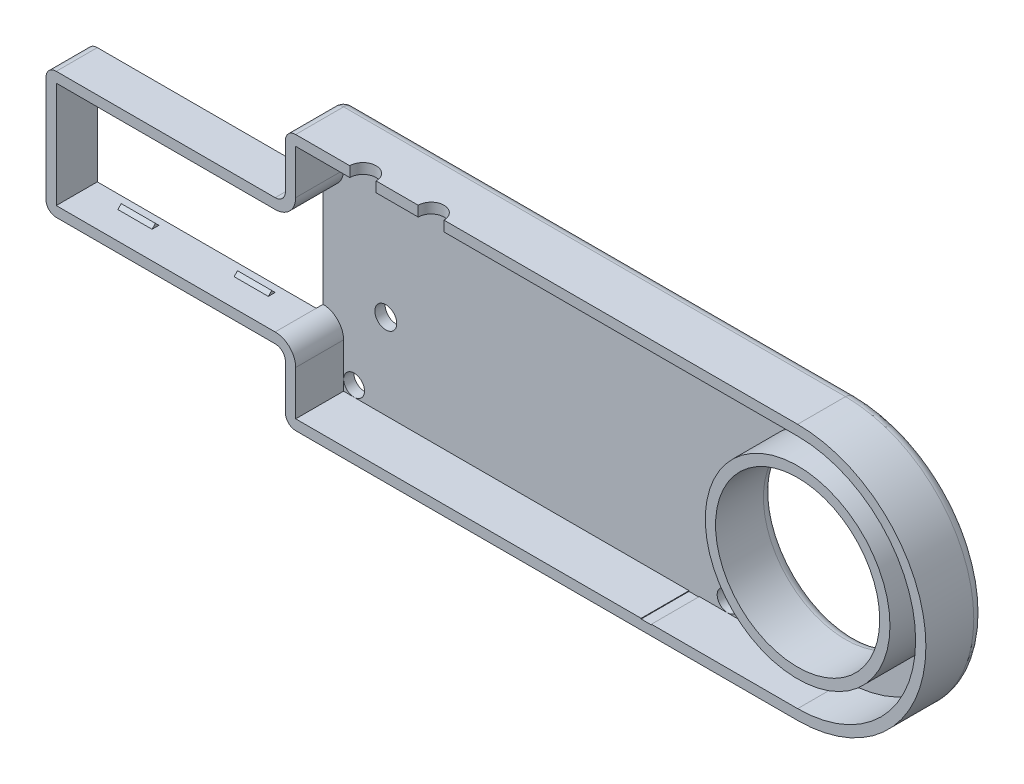
from build123d import *

# Parameters (mm, degrees)
BOSS_EXTRUDE1_DEPTH = 17
FILLET1_R           = 3
SHELL2_START        = 3
SHELL2_DEPTH        = 14
CUT_EXTRUDE1_START  = 3
SKETCH2_W           = 3
SKETCH2_H           = 69.184745233
CUT_EXTRUDE1_DEPTH  = 14
SKETCH4_R           = 24
BOSS_EXTRUDE2_DEPTH = 17
SHELL4_START        = 3
SHELL4_OUTLINE_R    = 27
SHELL4_DEPTH        = 14
SKETCH7_W           = 3
SKETCH7_H           = 69
CUT_EXTRUDE3_DEPTH  = 14
SKETCH8_R           = 3.051675087
CUT_EXTRUDE4_DEPTH  = 20
SKETCH9_R           = 3.853535646
SKETCH9_R_2         = 3.770722203
CUT_EXTRUDE5_DEPTH  = 20
SKETCH11_W          = 68.674120891
SKETCH11_H          = 38.021066824
CUT_EXTRUDE8_DEPTH  = 5
SKETCH15_W          = 10
SKETCH15_H          = 2
BOSS_EXTRUDE3_DEPTH = 1
CHAMFER1_SIZE       = 1
SKETCH14_W          = 10
SKETCH14_H          = 2
BOSS_EXTRUDE4_DEPTH = 1
CHAMFER2_SIZE       = 1
FILLET2_R           = 3
SKETCH16_R          = 3.2
CUT_EXTRUDE9_DEPTH  = 3


# Read off the part's stored shape, not the designer's step: Shell2, Shell4
with BuildPart() as part:
    # Sketch1 → Boss-Extrude1 (new body)
    with BuildSketch(Plane.XY):
        Polygon((-53.5, -18.5), (-53.5, -37.5), (53.5, -37.5), (53.5, 37.5), (-53.5, 37.5), (-53.5, 18.5), (-123.5, 18.5), (-123.5, -18.5), align=None)
    extrude(amount=BOSS_EXTRUDE1_DEPTH)

    # Fillet1
    fillet1_edges = [part.edges().sort_by_distance(p)[0] for p in [
        (-53.5, -37.5, 8.5),
        (-53.5, -18.5, 8.5),
        (-123.5, -18.5, 8.5),
        (-123.5, 18.5, 8.5),
        (-53.5, 18.5, 8.5),
        (-53.5, 37.5, 8.5),
    ]]
    fillet(fillet1_edges, radius=FILLET1_R)

    # Shell2 outline → Shell2 (cut)
    with BuildSketch(Plane.XY.offset(SHELL2_START)):
        with BuildLine():
            Line((50.5, -34.5), (50.5, 34.5))
            Line((50.5, 34.5), (-50.5, 34.5))
            Line((-50.5, 34.5), (-50.5, 21.5))
            ThreePointArc((-50.5, 21.5), (-52.257359313, 17.257359313), (-56.5, 15.5))
            Line((-56.5, 15.5), (-120.5, 15.5))
            Line((-120.5, 15.5), (-120.5, -15.5))
            Line((-120.5, -15.5), (-56.5, -15.5))
            ThreePointArc((-56.5, -15.5), (-52.257359313, -17.257359313), (-50.5, -21.5))
            Line((-50.5, -21.5), (-50.5, -34.5))
            Line((-50.5, -34.5), (50.5, -34.5))
        make_face()
    extrude(amount=SHELL2_DEPTH, mode=Mode.SUBTRACT)

    # Sketch2 → Cut-Extrude1 (cut)
    with BuildSketch(Plane.XY.offset(CUT_EXTRUDE1_START)):
        with Locations((52, -0.092372617)):
            Rectangle(SKETCH2_W, SKETCH2_H)
    extrude(amount=CUT_EXTRUDE1_DEPTH, mode=Mode.SUBTRACT)

    # Sketch4 → Boss-Extrude2 (add)
    with BuildSketch(Plane.XY):
        with BuildLine():
            Line((53.5, 37.5), (96.25236473, 37.5))
            ThreePointArc((96.25236473, 37.5), (133.75236473, 0), (96.25236473, -37.5))
            Line((96.25236473, -37.5), (53.5, -37.5))
            Line((53.5, -37.5), (53.5, 37.5))
        make_face()
        with Locations((96.25236473, 0)):
            Circle(SKETCH4_R, mode=Mode.SUBTRACT)
    extrude(amount=BOSS_EXTRUDE2_DEPTH)

    # Shell4 outline → Shell4 (cut)
    with BuildSketch(Plane.XY.offset(SHELL4_START)):
        with BuildLine():
            Line((96.25236473, 34.5), (56.5, 34.5))
            Line((56.5, 34.5), (56.5, -34.5))
            Line((56.5, -34.5), (96.25236473, -34.5))
            ThreePointArc((96.25236473, -34.5), (130.75236473, 0), (96.25236473, 34.5))
        make_face()
        with Locations((96.25236473, 0)):
            Circle(SHELL4_OUTLINE_R, mode=Mode.SUBTRACT)
    extrude(amount=SHELL4_DEPTH, mode=Mode.SUBTRACT)

    # Sketch7 → Cut-Extrude3 (cut)
    with BuildSketch(Plane.XY.offset(17)):
        with Locations((55, 0)):
            Rectangle(SKETCH7_W, SKETCH7_H)
    extrude(amount=-CUT_EXTRUDE3_DEPTH, mode=Mode.SUBTRACT)

    # Sketch8 → Cut-Extrude4 (cut)
    with BuildSketch(Plane(origin=(0, 0, 0), x_dir=(-1, 0, 0), z_dir=(0, 0, -1))):
        with Locations((47.431025643, -31.425786946)):
            Circle(SKETCH8_R)
        with Locations((47.407650962, 31.49020456)):
            Circle(SKETCH8_R)
        with Locations((-61.783104826, 31.350542021)):
            Circle(SKETCH8_R)
        with Locations((-61.783104826, -31.425786946)):
            Circle(SKETCH8_R)
    extrude(amount=-CUT_EXTRUDE4_DEPTH, mode=Mode.SUBTRACT)

    # Sketch9 → Cut-Extrude5 (cut)
    with BuildSketch(Plane(origin=(0, 37.5, 0), x_dir=(1, 0, 0), z_dir=(0, 1, 0))):
        with Locations((-30.827052477, -17)):
            Circle(SKETCH9_R)
        with Locations((-10.906615981, -16.992280087)):
            Circle(SKETCH9_R_2)
    extrude(amount=-CUT_EXTRUDE5_DEPTH, mode=Mode.SUBTRACT)

    # Sketch11 → Cut-Extrude8 (cut)
    with BuildSketch(Plane(origin=(0, 0, 0), x_dir=(-1, 0, 0), z_dir=(0, 0, -1))):
        with Locations((90.837060446, -0.510533412)):
            Rectangle(SKETCH11_W, SKETCH11_H)
    extrude(amount=-CUT_EXTRUDE8_DEPTH, mode=Mode.SUBTRACT)

    # Sketch15 → Boss-Extrude3 (add)
    with BuildSketch(Plane.XZ.offset(-15.5)):
        with Locations((-71.5, 8)):
            Rectangle(SKETCH15_W, SKETCH15_H)
        with Locations((-105.5, 8)):
            Rectangle(SKETCH15_W, SKETCH15_H)
    extrude(amount=BOSS_EXTRUDE3_DEPTH)

    # Chamfer1
    chamfer1_edges = [part.edges().sort_by_distance(p)[0] for p in [
        (-105.5, 14.5, 9),
        (-105.5, 14.5, 7),
        (-71.5, 14.5, 9),
        (-71.5, 14.5, 7),
    ]]
    chamfer(chamfer1_edges, length=CHAMFER1_SIZE - 0.0001)  # a hair under: the kernel refuses the full size

    # Sketch14 → Boss-Extrude4 (add)
    with BuildSketch(Plane(origin=(0, -15.5, 0), x_dir=(1, 0, 0), z_dir=(0, 1, 0))):
        with Locations((-71.5, -8)):
            Rectangle(SKETCH14_W, SKETCH14_H)
        with Locations((-105.5, -8)):
            Rectangle(SKETCH14_W, SKETCH14_H)
    extrude(amount=BOSS_EXTRUDE4_DEPTH)

    # Chamfer2
    chamfer2_edges = [part.edges().sort_by_distance(p)[0] for p in [
        (-105.5, -14.5, 7),
        (-105.5, -14.5, 9),
        (-71.5, -14.5, 9),
        (-71.5, -14.5, 7),
    ]]
    chamfer(chamfer2_edges, length=CHAMFER2_SIZE - 0.0001)  # a hair under: the kernel refuses the full size

    # Fillet2
    fillet2_edges = [part.edges().sort_by_distance(p)[0] for p in [
        (72.25236473, 0, 0),
        (133.75236473, 0, 0),
        (22.876182365, 37.5, 0),
        (22.876182365, -37.5, 0),
        (-53.5, -28, 0),
        (-53.5, 28, 0),
        (-52.621320344, 36.621320344, 0),
        (-52.621320344, -36.621320344, 0),
        (-54.378679656, -19.378679656, 0),
        (-54.378679656, 19.378679656, 0),
    ]]
    fillet(fillet2_edges, radius=FILLET2_R)

    # Sketch16 → Cut-Extrude9 (cut)
    with BuildSketch(Plane(origin=(0, 0, 0), x_dir=(-1, 0, 0), z_dir=(0, 0, -1))):
        with Locations((38.150596078, -9.60262109)):
            Circle(SKETCH16_R)
    extrude(amount=-CUT_EXTRUDE9_DEPTH, mode=Mode.SUBTRACT)


solid = part.part
